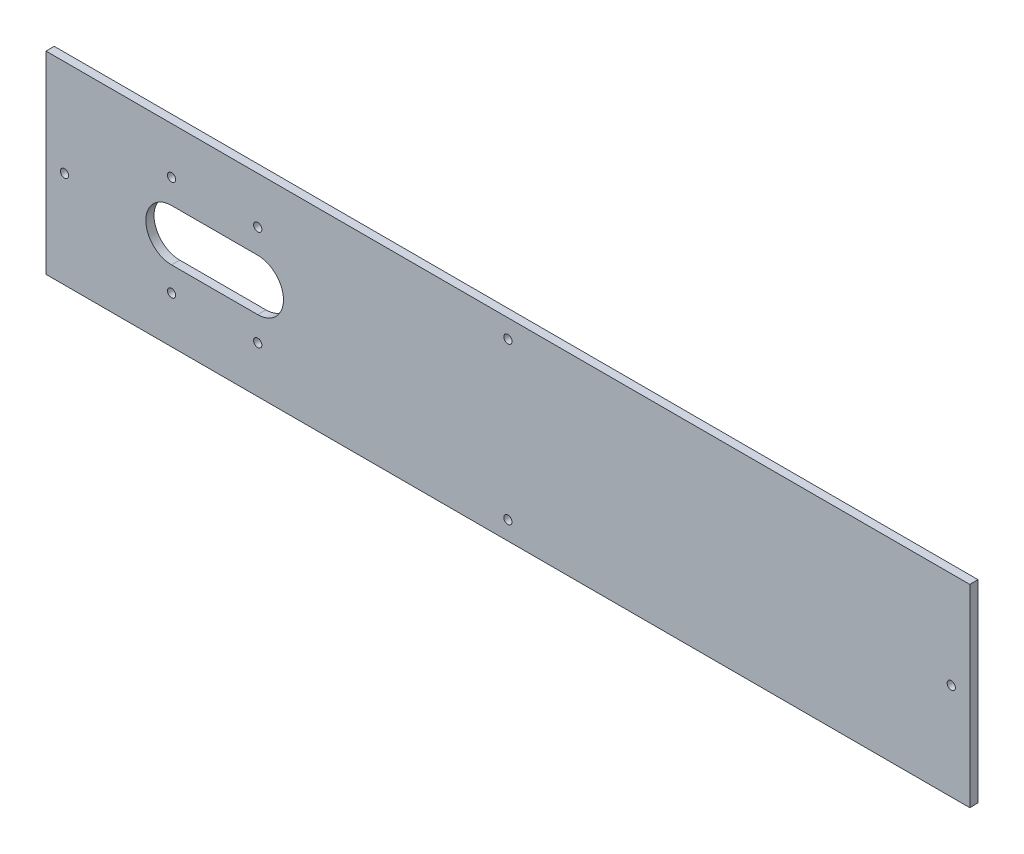
from build123d import *

# Parameters (mm, degrees)
SCHIZZO1_W                   = 449
SCHIZZO1_H                   = 94
SCHIZZO1_R                   = 2
ESTRUSIONE_ESTRUSIONE1_DEPTH = 4


with BuildPart() as part:
    # Schizzo1 → Estrusione-Estrusione1 (new body)
    with BuildSketch(Plane.XY):
        with Locations((-224.5, 47)):
            Rectangle(SCHIZZO1_W, SCHIZZO1_H)
        with Locations((-9, 47)):
            Circle(SCHIZZO1_R, mode=Mode.SUBTRACT)
        with Locations((-224.5, 85)):
            Circle(SCHIZZO1_R, mode=Mode.SUBTRACT)
        with Locations((-440, 47)):
            Circle(SCHIZZO1_R, mode=Mode.SUBTRACT)
        with Locations((-224.5, 9)):
            Circle(SCHIZZO1_R, mode=Mode.SUBTRACT)
        with Locations((-346.089478823, 71.339471067)):
            Circle(SCHIZZO1_R, mode=Mode.SUBTRACT)
        with Locations((-346.089478823, 22.660528933)):
            Circle(SCHIZZO1_R, mode=Mode.SUBTRACT)
        with Locations((-387.978760649, 22.660528933)):
            Circle(SCHIZZO1_R, mode=Mode.SUBTRACT)
        with Locations((-387.978760649, 71.339471067)):
            Circle(SCHIZZO1_R, mode=Mode.SUBTRACT)
        with BuildLine():
            Line((-387.978760649, 59.5), (-346.089478823, 59.5))
            ThreePointArc((-346.089478823, 59.5), (-333.589478823, 47), (-346.089478823, 34.5))
            Line((-346.089478823, 34.5), (-387.978760649, 34.5))
            ThreePointArc((-387.978760649, 34.5), (-400.478760649, 47), (-387.978760649, 59.5))
        make_face(mode=Mode.SUBTRACT)
    extrude(amount=ESTRUSIONE_ESTRUSIONE1_DEPTH)


solid = part.part
